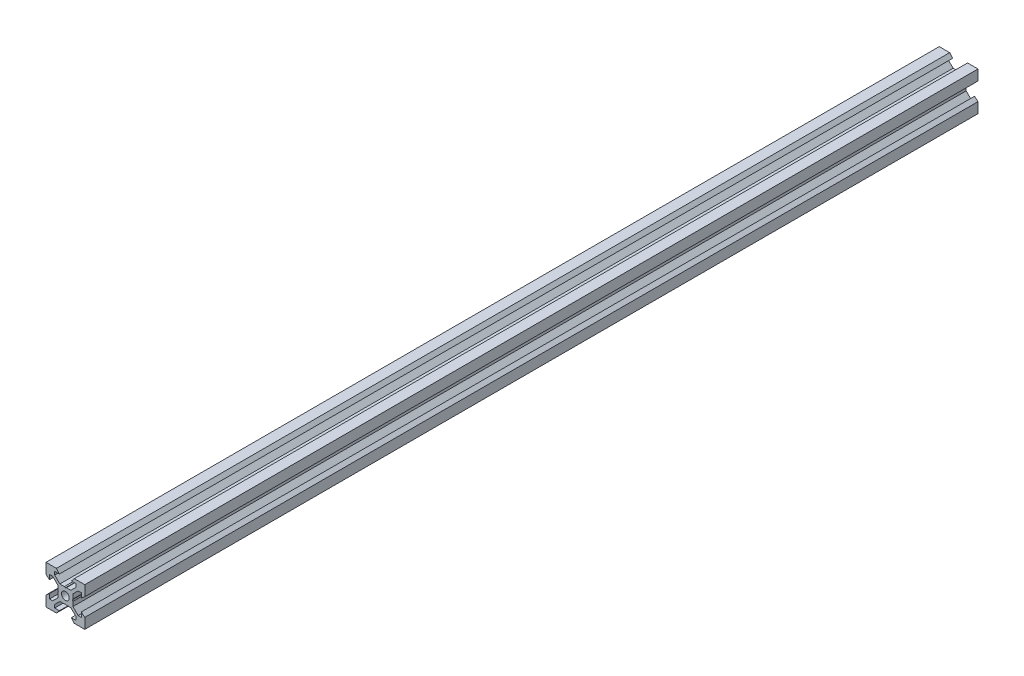
from build123d import *

# Parameters (mm, degrees)
SKETCH1_R           = 2
BOSS_EXTRUDE1_DEPTH = 230.5


with BuildPart() as part:
    # Sketch1 → Boss-Extrude1 (new, symmetric)
    with BuildSketch(Plane.XY):
        Polygon((10, 4.610379336), (10, 10), (4.610379336, 10), (3.1, 8.2), (5.5, 8.2), (5.5, 6.560660172), (2.839339828, 3.9), (0.519615242, 3.9), (0, 3.6), (-0.519615242, 3.9), (-2.839339828, 3.9), (-5.5, 6.560660172), (-5.5, 8.2), (-3.1, 8.2), (-4.610379336, 10), (-10, 10), (-10, 4.610379336), (-8.2, 3.1), (-8.2, 5.5), (-6.560660172, 5.5), (-3.9, 2.839339828), (-3.9, 0.519615242), (-3.6, 0), (-3.9, -0.519615242), (-3.9, -2.839339828), (-6.560660172, -5.5), (-8.2, -5.5), (-8.2, -3.1), (-10, -4.610379336), (-10, -10), (-4.610379336, -10), (-3.1, -8.2), (-5.5, -8.2), (-5.5, -6.560660172), (-2.839339828, -3.9), (-0.519615242, -3.9), (0, -3.6), (0.519615242, -3.9), (2.839339828, -3.9), (5.5, -6.560660172), (5.5, -8.2), (3.1, -8.2), (4.610379336, -10), (10, -10), (10, -4.610379336), (8.2, -3.1), (8.2, -5.5), (6.560660172, -5.5), (3.9, -2.839339828), (3.9, -0.519615242), (3.6, 0), (3.9, 0.519615242), (3.9, 2.839339828), (6.560660172, 5.5), (8.2, 5.5), (8.2, 3.1), align=None)
        Circle(SKETCH1_R, mode=Mode.SUBTRACT)
    extrude(amount=BOSS_EXTRUDE1_DEPTH, both=True)


solid = part.part
